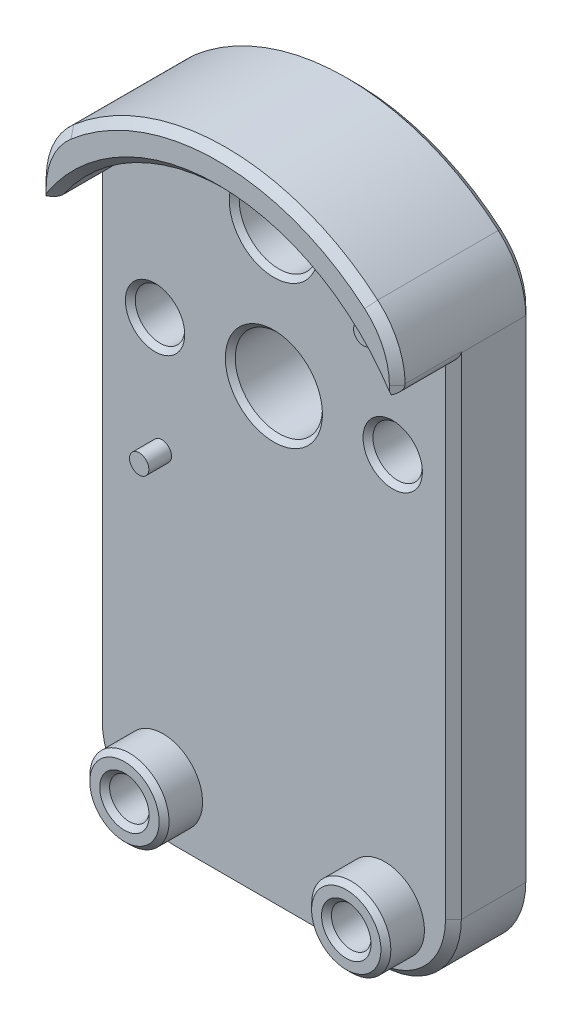
from build123d import *

# Parameters (mm, degrees)
SKETCH2_R           = 3.4925
BOSS_EXTRUDE1_DEPTH = 6.437503
BOSS_EXTRUDE5_DEPTH = 4.4958
CUT_EXTRUDE7_REACH  = 41.77
SKETCH17_R          = 1.9812
SKETCH13_R          = 1.5875
CUT_EXTRUDE5_DEPTH  = 40.769967311
SKETCH7_R           = 3.96875
BOSS_EXTRUDE4_DEPTH = 3.175
SKETCH14_R          = 3.175
CUT_EXTRUDE6_DEPTH  = 41.73997999
BOSS_EXTRUDE7_START = 3.087497
SKETCH15_R          = 3.175
SKETCH15_R_2        = 1.5875
BOSS_EXTRUDE7_DEPTH = 3.087497
SKETCH16_R          = 0.7747
BOSS_EXTRUDE8_DEPTH = 8.255
CUT_EXTRUDE8_DEPTH  = 2.8448
CHAMFER1_SIZE       = 0.396875
FILLET1_R           = 6.35
CHAMFER2_SIZE       = 0.635
FILLET2_R           = 0.79375


with BuildPart() as part:
    # Sketch2 → Boss-Extrude1 (new body)
    with BuildSketch(Plane.XY):
        with BuildLine():
            Line((14.3891, -36.5125), (-14.3891, -36.5125))
            Line((-14.3891, -36.5125), (-14.3891, 11.742361964))
            ThreePointArc((-14.3891, 11.742361964), (0, 18.5166), (14.3891, 11.742361964))
            Line((14.3891, 11.742361964), (14.3891, -36.5125))
        make_face()
        Circle(SKETCH2_R, mode=Mode.SUBTRACT)
    extrude(amount=BOSS_EXTRUDE1_DEPTH)

    # Sketch12 → Boss-Extrude5 (add)
    with BuildSketch(Plane.XY.offset(6.437503)):
        with BuildLine():
            Line((-14.3891, 6.247076947), (-14.3891, 11.742361964))
            ThreePointArc((-14.3891, 11.742361964), (0, 18.5166), (14.3891, 11.742361964))
            Line((14.3891, 11.742361964), (14.3891, 6.247076947))
            ThreePointArc((14.3891, 6.247076947), (0, 15.5956), (-14.3891, 6.247076947))
        make_face()
    extrude(amount=BOSS_EXTRUDE5_DEPTH)

    # Sketch17 → Cut-Extrude7 (cut, up to next)
    with BuildSketch(Plane.XY.offset(6.437503), mode=Mode.PRIVATE) as cut_extrude7_sk1:
        with Locations((-9.525, 0)):
            Circle(SKETCH17_R)
    cut_extrude7_tool1 = extrude(cut_extrude7_sk1.sketch, amount=-CUT_EXTRUDE7_REACH, mode=Mode.PRIVATE) & part.part
    # Sketch17 → Cut-Extrude7 (cut, up to next)
    with BuildSketch(Plane.XY.offset(6.437503), mode=Mode.PRIVATE) as cut_extrude7_sk2:
        with Locations((9.525, 0)):
            Circle(SKETCH17_R)
    cut_extrude7_tool2 = extrude(cut_extrude7_sk2.sketch, amount=-CUT_EXTRUDE7_REACH, mode=Mode.PRIVATE) & part.part
    add(cut_extrude7_tool1.solids().sort_by_distance((-9.525, 0, 6.437503))[0], mode=Mode.SUBTRACT)
    add(cut_extrude7_tool2.solids().sort_by_distance((9.525, 0, 6.437503))[0], mode=Mode.SUBTRACT)

    # Sketch13 → Cut-Extrude5 (cut, through all)
    with BuildSketch(Plane.XY.offset(6.437503)):
        with Locations((8.89, -31.75)):
            Circle(SKETCH13_R)
        with Locations((-8.89, -31.75)):
            Circle(SKETCH13_R)
    extrude(amount=-CUT_EXTRUDE5_DEPTH, mode=Mode.SUBTRACT)

    # Sketch7 → Boss-Extrude4 (add)
    with BuildSketch(Plane(origin=(0, 0, 0), x_dir=(-1, 0, 0), z_dir=(0, 0, -1))):
        with Locations((0, -15.875)):
            Circle(SKETCH7_R)
    extrude(amount=BOSS_EXTRUDE4_DEPTH)

    # Sketch14 → Cut-Extrude6 (cut, through all)
    with BuildSketch(Plane(origin=(0, 0, 0), x_dir=(-1, 0, 0), z_dir=(0, 0, -1))):
        with Locations((0, 11.1125)):
            Circle(SKETCH14_R)
    extrude(amount=-CUT_EXTRUDE6_DEPTH, mode=Mode.SUBTRACT)

    # Sketch15 → Boss-Extrude7 (add)
    # profile 1 of 2: a face of its own
    with BuildSketch(Plane.XY.offset(6.437503).offset(BOSS_EXTRUDE7_START)):
        with Locations(Location((-8.89, -31.75, 0), (0, 0, 180))):
            Circle(SKETCH15_R)
        with Locations((-8.89, -31.75)):
            Circle(SKETCH15_R_2, mode=Mode.SUBTRACT)
    # profile 2 of 2: a face of its own
    with BuildSketch(Plane.XY.offset(6.437503).offset(BOSS_EXTRUDE7_START)):
        with Locations(Location((8.89, -31.75, 0), (0, 0, 180))):
            Circle(SKETCH15_R)
        with Locations((8.89, -31.75)):
            Circle(SKETCH15_R_2, mode=Mode.SUBTRACT)
    extrude(amount=-BOSS_EXTRUDE7_DEPTH)

    # Sketch16 → Boss-Extrude8 (add)
    with BuildSketch(Plane.XY):
        with Locations(Location((8.979999998, 8.979999998, 0), (0, 0, 180))):
            Circle(SKETCH16_R)
        with Locations(Location((-8.980000074, -8.980000074, 0), (0, 0, 180))):
            Circle(SKETCH16_R)
    extrude(amount=BOSS_EXTRUDE8_DEPTH)

    # Sketch11 → Cut-Extrude8 (cut)
    with BuildSketch(Plane(origin=(0, 0, 0), x_dir=(-1, 0, 0), z_dir=(0, 0, -1))):
        Polygon((9.525, -3.372880273), (12.446, -1.686440136), (12.446, 1.686440136), (9.525, 3.372880273), (6.604, 1.686440136), (6.604, -1.686440136), align=None)
        Polygon((-6.604, -1.686440136), (-6.604, 1.686440136), (-9.525, 3.372880273), (-12.446, 1.686440136), (-12.446, -1.686440136), (-9.525, -3.372880273), align=None)
    extrude(amount=-CUT_EXTRUDE8_DEPTH, mode=Mode.SUBTRACT)

    # Chamfer1
    chamfer1_edges = [part.edges().sort_by_distance(p)[0] for p in [
        (8.0645, -2.529660204, 0),
        (6.604, 0, 0),
        (8.0645, 2.529660204, 0),
        (10.9855, 2.529660204, 0),
        (12.446, 0, 0),
        (10.9855, -2.529660204, 0),
        (-3.4925, 0, 0),
        (-3.4925, 0, 6.437503),
        (-11.5062, 0, 6.437503),
        (7.5438, 0, 6.437503),
        (7.3025, -31.75, 0),
        (-10.4775, -31.75, 0),
        (3.96875, -15.875, -3.175),
        (3.175, 11.1125, 6.437503),
        (3.175, 11.1125, 0),
        (-5.715, -31.75, 9.525),
        (-10.4775, -31.75, 9.525),
        (12.065, -31.75, 9.525),
        (7.3025, -31.75, 9.525),
        (-8.0645, -2.529660204, 0),
        (-10.9855, -2.529660204, 0),
        (-12.446, 0, 0),
        (-10.9855, 2.529660204, 0),
        (-8.0645, 2.529660204, 0),
        (-6.604, 0, 0),
    ]]
    chamfer(chamfer1_edges, length=CHAMFER1_SIZE)

    # Fillet1
    fillet1_edges = [part.edges().sort_by_distance(p)[0] for p in [
        (14.3891, -36.5125, 3.2187515),
        (-14.3891, -36.5125, 3.2187515),
        (-14.3891, 11.742361964, 5.4666515),
        (14.3891, 11.742361964, 5.4666515),
    ]]
    fillet(fillet1_edges, radius=FILLET1_R)

    # Chamfer2
    chamfer2_edges = [part.edges().sort_by_distance(p)[0] for p in [
        (-14.3891, -11.957711527, 6.437503),
        (14.3891, -10.490260477, 0),
        (14.3891, -11.957711527, 6.437503),
        (0, -36.5125, 0),
        (-14.3891, -10.490260477, 0),
        (0, 18.5166, 0),
        (0, 15.5956, 10.933303),
        (13.811276754, 11.828576016, 0),
        (-13.811276754, 11.828576016, 0),
        (-12.529228061, -34.652628061, 0),
        (12.529228061, -34.652628061, 0),
        (0, -36.5125, 6.437503),
        (14.3891, 7.714527997, 10.933303),
        (-12.529228061, -34.652628061, 6.437503),
        (12.529228061, -34.652628061, 6.437503),
        (-14.3891, 7.714527997, 10.933303),
        (0, 18.5166, 10.933303),
        (13.811276754, 11.828576016, 10.933303),
        (-13.811276754, 11.828576016, 10.933303),
    ]]
    chamfer(chamfer2_edges, length=CHAMFER2_SIZE)

    # Fillet2
    # the kernel refuses this fillet: 0.79375 mm, written as the material it takes off along each edge
    with BuildSketch(Plane(origin=(-14.3891, 6.247076947, 17.892212695), x_dir=(0.0002732221102440435, 0.9999999626748386, 0), z_dir=(0, 0, -1))) as fillet2_piece_1_section:
        with BuildLine():
            CenterArc((3.024948012, 0.793649735), FILLET2_R, 124.715226163, 146.195471544)
            Line((2.572908986, 1.446106463), (2.527705084, 1.511352136))
            ThreePointArc((2.527705084, 1.511352136), (1.281516556, 0.731838796), (-0.032235611, 0.072534516))
            Line((-0.032235611, 0.072534516), (-2.1687e-05, -0.079374997))
            ThreePointArc((-2.1687e-05, -0.079374997), (2.934880304, -0.080176877), (3.038825464, -0.079364974))
            Line((3.038825464, -0.079364974), (3.037563878, 0))
        make_face()
    fillet2_piece_1 = extrude(amount=19.683619389, mode=Mode.PRIVATE)
    fillet2_piece_1 = split(fillet2_piece_1, bisect_by=Plane(origin=(-14.022158443, 7.803224896, 6.437503), z_dir=(0, 0, 1)), keep=Keep.TOP, mode=Mode.PRIVATE)
    fillet2_piece_1 = split(fillet2_piece_1, bisect_by=Plane(origin=(-11.009501919, 7.803224896, 9.182101081), z_dir=(-0.7071067811865476, 0, 0.7071067811865476)), keep=Keep.TOP, mode=Mode.PRIVATE)
    add(fillet2_piece_1, mode=Mode.SUBTRACT)
    with BuildSketch(Plane(origin=(-14.3891, 6.247076947, 17.892212695), x_dir=(0.0002732221102440435, 0.9999999626748386, 0), z_dir=(0, 0, -1))) as fillet2_piece_2_section:
        with BuildLine():
            CenterArc((3.024948012, 0.793649735), FILLET2_R, 124.715226163, 146.195471544)
            Line((2.572908986, 1.446106463), (2.527705084, 1.511352136))
            ThreePointArc((2.527705084, 1.511352136), (1.281516556, 0.731838796), (-0.032235611, 0.072534516))
            Line((-0.032235611, 0.072534516), (-2.1687e-05, -0.079374997))
            ThreePointArc((-2.1687e-05, -0.079374997), (2.934880304, -0.080176877), (3.038825464, -0.079364974))
            Line((3.038825464, -0.079364974), (3.037563878, 0))
        make_face()
    fillet2_piece_2 = extrude(amount=19.683619389, mode=Mode.PRIVATE)
    fillet2_piece_2 = split(fillet2_piece_2, bisect_by=Plane(origin=(-13.314712844, 8.331467519, 6.437503), z_dir=(0, 0, 1)), keep=Keep.TOP, mode=Mode.PRIVATE)
    fillet2_piece_2 = split(fillet2_piece_2, bisect_by=Plane(origin=(-13.424559633, 8.331467519, 6.767043367), z_dir=(0.7071067811865476, 0, -0.7071067811865476)), keep=Keep.TOP, mode=Mode.PRIVATE)
    add(fillet2_piece_2, mode=Mode.SUBTRACT)
    with BuildSketch(Plane(origin=(-14.3891, 6.247076947, 17.892212695), x_dir=(0.0002732221102440435, 0.9999999626748386, 0), z_dir=(0, 0, -1))) as fillet2_piece_3_section:
        with BuildLine():
            CenterArc((3.024948012, 0.793649735), FILLET2_R, 124.715226163, 146.195471544)
            Line((2.572908986, 1.446106463), (2.527705084, 1.511352136))
            ThreePointArc((2.527705084, 1.511352136), (1.281516556, 0.731838796), (-0.032235611, 0.072534516))
            Line((-0.032235611, 0.072534516), (-2.1687e-05, -0.079374997))
            ThreePointArc((-2.1687e-05, -0.079374997), (2.934880304, -0.080176877), (3.038825464, -0.079364974))
            Line((3.038825464, -0.079364974), (3.037563878, 0))
        make_face()
    fillet2_piece_3 = extrude(amount=19.683619389, mode=Mode.PRIVATE)
    fillet2_piece_3 = split(fillet2_piece_3, bisect_by=Plane(origin=(-14.26899261, 7.67744115, 6.437503), z_dir=(0, 0, -1)), keep=Keep.TOP, mode=Mode.PRIVATE)
    fillet2_piece_3 = split(fillet2_piece_3, bisect_by=Plane(origin=(-14.140269457, 7.67744115, 6.051333543), z_dir=(-0.7071067811865476, 0, 0.7071067811865476)), keep=Keep.TOP, mode=Mode.PRIVATE)
    add(fillet2_piece_3, mode=Mode.SUBTRACT)
    with BuildSketch(Plane(origin=(14.3891, 6.247076947, -1.791406695), x_dir=(-0.0002732221102440462, 0.9999999626748386, 5.927476528362276e-15), z_dir=(0, 0, 1))) as fillet2_piece_4_section:
        with BuildLine():
            CenterArc((3.024948012, 0.793649735), FILLET2_R, 124.715226163, 146.195471544)
            Line((2.572908986, 1.446106463), (2.527705084, 1.511352136))
            ThreePointArc((2.527705084, 1.511352136), (1.281516556, 0.731838796), (-0.032235611, 0.072534516))
            Line((-0.032235611, 0.072534516), (-2.1687e-05, -0.079374997))
            ThreePointArc((-2.1687e-05, -0.079374997), (2.934880304, -0.080176877), (3.038825464, -0.079364974))
            Line((3.038825464, -0.079364974), (3.037563878, 0))
        make_face()
    fillet2_piece_4 = extrude(amount=19.683619389, mode=Mode.PRIVATE)
    fillet2_piece_4 = split(fillet2_piece_4, bisect_by=Plane(origin=(13.314712844, 8.331467519, 6.437503), z_dir=(0, 0, 1)), keep=Keep.TOP, mode=Mode.PRIVATE)
    fillet2_piece_4 = split(fillet2_piece_4, bisect_by=Plane(origin=(13.424559633, 8.331467519, 6.767043367), z_dir=(-0.7071067811865476, 0, -0.7071067811865476)), keep=Keep.TOP, mode=Mode.PRIVATE)
    add(fillet2_piece_4, mode=Mode.SUBTRACT)
    with BuildSketch(Plane(origin=(14.3891, 6.247076947, -1.791406695), x_dir=(-0.0002732221102440462, 0.9999999626748386, 5.927476528362276e-15), z_dir=(0, 0, 1))) as fillet2_piece_5_section:
        with BuildLine():
            CenterArc((3.024948012, 0.793649735), FILLET2_R, 124.715226163, 146.195471544)
            Line((2.572908986, 1.446106463), (2.527705084, 1.511352136))
            ThreePointArc((2.527705084, 1.511352136), (1.281516556, 0.731838796), (-0.032235611, 0.072534516))
            Line((-0.032235611, 0.072534516), (-2.1687e-05, -0.079374997))
            ThreePointArc((-2.1687e-05, -0.079374997), (2.934880304, -0.080176877), (3.038825464, -0.079364974))
            Line((3.038825464, -0.079364974), (3.037563878, 0))
        make_face()
    fillet2_piece_5 = extrude(amount=19.683619389, mode=Mode.PRIVATE)
    fillet2_piece_5 = split(fillet2_piece_5, bisect_by=Plane(origin=(14.26899261, 7.67744115, 6.437503), z_dir=(0, 0, -1)), keep=Keep.TOP, mode=Mode.PRIVATE)
    fillet2_piece_5 = split(fillet2_piece_5, bisect_by=Plane(origin=(14.140269457, 7.67744115, 6.051333543), z_dir=(0.7071067811865476, 0, 0.7071067811865476)), keep=Keep.TOP, mode=Mode.PRIVATE)
    add(fillet2_piece_5, mode=Mode.SUBTRACT)
    with BuildSketch(Plane(origin=(14.3891, 6.247076947, -1.791406695), x_dir=(-0.0002732221102440462, 0.9999999626748386, 5.927476528362276e-15), z_dir=(0, 0, 1))) as fillet2_piece_6_section:
        with BuildLine():
            CenterArc((3.024948012, 0.793649735), FILLET2_R, 124.715226163, 146.195471544)
            Line((2.572908986, 1.446106463), (2.527705084, 1.511352136))
            ThreePointArc((2.527705084, 1.511352136), (1.281516556, 0.731838796), (-0.032235611, 0.072534516))
            Line((-0.032235611, 0.072534516), (-2.1687e-05, -0.079374997))
            ThreePointArc((-2.1687e-05, -0.079374997), (2.934880304, -0.080176877), (3.038825464, -0.079364974))
            Line((3.038825464, -0.079364974), (3.037563878, 0))
        make_face()
    fillet2_piece_6 = extrude(amount=19.683619389, mode=Mode.PRIVATE)
    fillet2_piece_6 = split(fillet2_piece_6, bisect_by=Plane(origin=(14.022158443, 7.803224896, 6.437503), z_dir=(0, 0, 1)), keep=Keep.TOP, mode=Mode.PRIVATE)
    fillet2_piece_6 = split(fillet2_piece_6, bisect_by=Plane(origin=(11.009501919, 7.803224896, 9.182101081), z_dir=(0.7071067811865476, 0, 0.7071067811865476)), keep=Keep.TOP, mode=Mode.PRIVATE)
    add(fillet2_piece_6, mode=Mode.SUBTRACT)


solid = part.part
